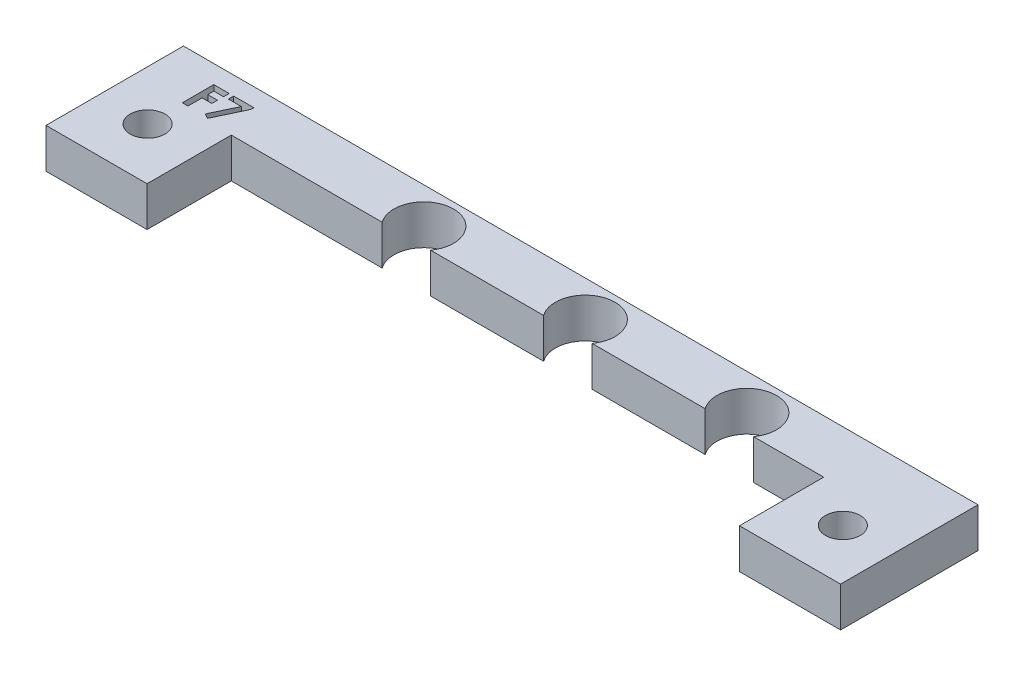
from build123d import *

# Parameters (mm, degrees)
BOSS_EXTRUDE1_OUTLINE_R = 1.75
BOSS_EXTRUDE1_DEPTH     = 4
CUT_EXTRUDE1_DEPTH      = 1


# Read off the part's stored shape, not the designer's step: Boss-Extrude1
with BuildPart() as part:
    # Boss-Extrude1 outline → Boss-Extrude1 (new body)
    with BuildSketch(Plane(origin=(0, 0, 0), x_dir=(1, 0, 0), z_dir=(0, 1, 0))):
        with BuildLine():
            Line((25.196474615, -10.33744254), (36.58307775, -10.33744254))
            ThreePointArc((36.58307775, -10.33744254), (39.019776183, -5.587442326), (41.456474615, -10.33744254))
            Line((41.456474615, -10.33744254), (48.519776182, -10.33744254))
            Line((48.519776182, -10.33744254), (48.519776182, -18.81631662))
            Line((48.519776182, -18.81631662), (58.694776182, -18.81631662))
            Line((58.694776182, -18.81631662), (58.694776182, -4.977921711))
            Line((58.694776182, -4.977921711), (-21.305223818, -4.977921711))
            Line((-21.305223818, -4.977921711), (-21.305223818, -18.81631662))
            Line((-21.305223818, -18.81631662), (-11.130223818, -18.81631662))
            Line((-11.130223818, -18.81631662), (-11.130223818, -10.33744254))
            Line((-11.130223818, -10.33744254), (4.06307775, -10.33744254))
            ThreePointArc((4.06307775, -10.33744254), (6.499776182, -5.587442326), (8.936474615, -10.33744254))
            Line((8.936474615, -10.33744254), (20.32307775, -10.33744254))
            ThreePointArc((20.32307775, -10.33744254), (22.759776182, -5.587442326), (25.196474615, -10.33744254))
        make_face()
        with Locations((-16.305223818, -13.587442433)):
            Circle(BOSS_EXTRUDE1_OUTLINE_R, mode=Mode.SUBTRACT)
        with Locations((53.694776182, -13.587442433)):
            Circle(BOSS_EXTRUDE1_OUTLINE_R, mode=Mode.SUBTRACT)
    extrude(amount=BOSS_EXTRUDE1_DEPTH)

    # Sketch2 → Cut-Extrude1 (cut)
    with BuildSketch(Plane(origin=(0, 4, 0), x_dir=(1, 0, 0), z_dir=(0, 1, 0))):
        Polygon((-16.41198232, -6.812466594), (-14.865187448, -6.812466594), (-14.865187448, -7.382338389), (-15.842110525, -7.382338389), (-15.842110525, -7.992915312), (-14.865187448, -7.992915312), (-14.865187448, -8.562787107), (-15.842110525, -8.562787107), (-15.842110525, -9.987466594), (-16.41198232, -9.987466594), align=None)
        Polygon((-14.417431038, -6.812466594), (-12.382174628, -6.812466594), (-12.382174628, -7.108214791), (-13.782685445, -10.06887685), (-14.287047424, -9.814469799), (-13.117411006, -7.341633261), (-14.417431038, -7.341633261), align=None)
    extrude(amount=-CUT_EXTRUDE1_DEPTH, mode=Mode.SUBTRACT)


solid = part.part
